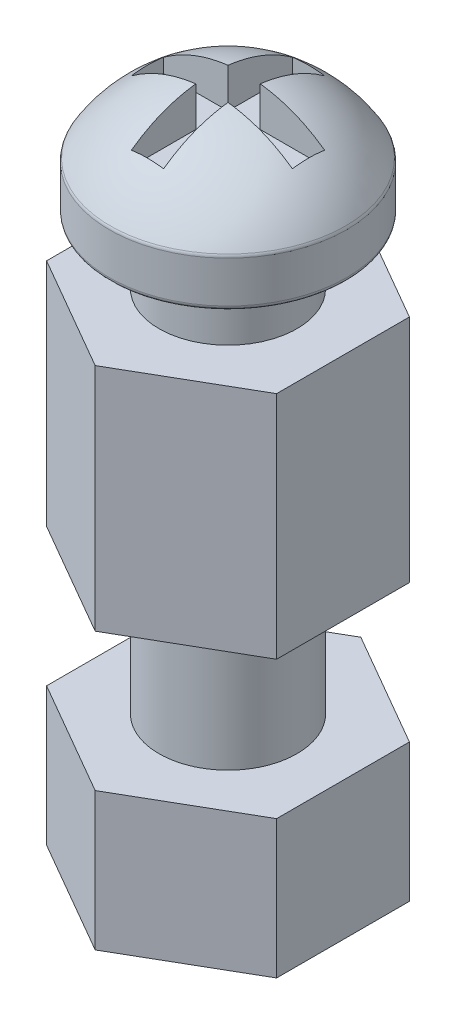
from build123d import *

# Parameters (mm, degrees)
BOSS_EXTRUDE1_DEPTH = 5
SKETCH1_4_R         = 1.5
BOSS_EXTRUDE2_DEPTH = 6
CUT_EXTRUDE1_DEPTH  = 7
FILLET1_R           = 0.1
SKETCH5_R           = 1.5
BOSS_EXTRUDE3_DEPTH = 3


with BuildPart() as part:
    # Sketch1 → Boss-Extrude1 (new body)
    with BuildSketch(Plane(origin=(0, 0, 0), x_dir=(1, 0, 0), z_dir=(0, 1, 0))):
        Polygon((2.5, -1.443375673), (2.5, 1.443375673), (0, 2.886751346), (-2.5, 1.443375673), (-2.5, -1.443375673), (0, -2.886751346), align=None)
    extrude(amount=BOSS_EXTRUDE1_DEPTH)

    # Sketch1<4> → Boss-Extrude2 (add)
    with BuildSketch(Plane(origin=(0, 0, 0), x_dir=(1, 0, 0), z_dir=(0, 1, 0))):
        Circle(SKETCH1_4_R)
    extrude(amount=-BOSS_EXTRUDE2_DEPTH)

    # Sketch3 → Revolve1 (revolve)
    with BuildSketch(Plane.XY):
        with BuildLine():
            Line((0, 5), (1.5, 5))
            Line((1.5, 5), (1.5, 6.4))
            Line((1.5, 6.4), (2.577677109, 6.4))
            Line((2.577677109, 6.4), (2.577677109, 7.4))
            ThreePointArc((2.577677109, 7.4), (2.572999105, 7.433876498), (2.559315235, 7.465217406))
            ThreePointArc((2.559315235, 7.465217406), (1.467028933, 8.516835132), (0, 8.9))
            Line((0, 8.9), (0, 5))
        make_face()
    revolve(axis=Axis((0, 5, 0), (0, -1, 0)))

    # Sketch4 → Cut-Extrude1 (cut)
    with BuildSketch(Plane(origin=(0, 15, 0), x_dir=(1, 0, 0), z_dir=(0, 1, 0))):
        Polygon((-1.75, 0.35), (-1.75, -0.35), (-0.35, -0.35), (-0.35, -1.75), (0.35, -1.75), (0.35, -0.35), (1.75, -0.35), (1.75, 0.35), (0.35, 0.35), (0.35, 1.75), (-0.35, 1.75), (-0.35, 0.35), align=None)
    extrude(amount=-CUT_EXTRUDE1_DEPTH, mode=Mode.SUBTRACT)

    # Fillet1
    fillet1_edges = [part.edges().sort_by_distance(p)[0] for p in [
        (-2.577677109, 6.4, 0),
    ]]
    fillet(fillet1_edges, radius=FILLET1_R)


with BuildPart() as body_2:
    # Sketch5 → Boss-Extrude3 (new body)
    with BuildSketch(Plane.XZ.offset(6)):
        Polygon((2.5, 1.443375673), (0, 2.886751346), (-2.5, 1.443375673), (-2.5, -1.443375673), (0, -2.886751346), (2.5, -1.443375673), align=None)
        Circle(SKETCH5_R, mode=Mode.SUBTRACT)
    extrude(amount=-BOSS_EXTRUDE3_DEPTH)


solid = Compound([part.part, body_2.part])
